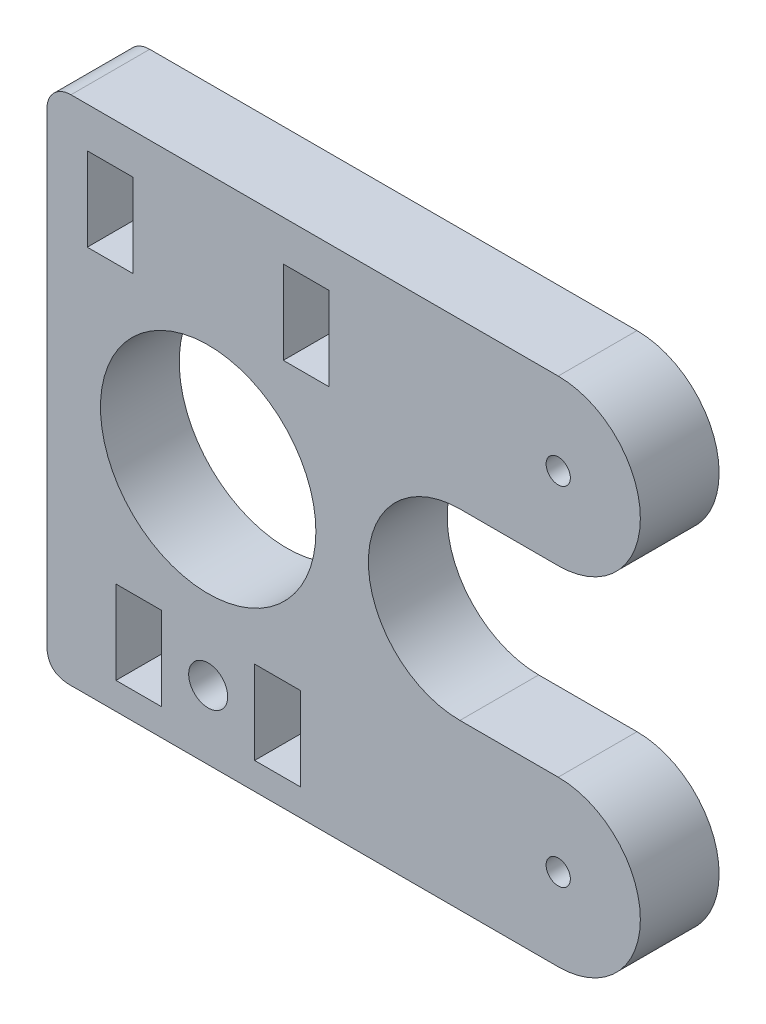
from build123d import *

# Parameters (mm, degrees)
SKETCH1_R           = 0.899918091
SKETCH1_R_2         = 0.899925125
SKETCH1_R_3         = 1.45
SKETCH1_R_4         = 8
SKETCH1_W           = 3.400011
SKETCH1_H           = 6.2
SKETCH1_W_2         = 3.4
BOSS_EXTRUDE2_DEPTH = 5.85


with BuildPart() as part:
    # Sketch1 → Boss-Extrude2 (new body)
    with BuildSketch(Plane.XY):
        with BuildLine():
            Line((669.21684417, 349.76545661), (648.535749201, 349.76545661))
            ThreePointArc((648.535749201, 349.76545661), (647.270566291, 349.24140069), (646.746510371, 347.976217781))
            Line((646.746510371, 347.976217781), (646.746510371, 313.454646051))
            add(Edge.make_bspline(
                [(646.746510371, 313.454646051), (646.746510371, 311.64647079), (648.773268796, 311.76545661)],
                knots=[0, 0, 0, 1, 1, 1], degree=2))
            Line((648.773268796, 311.76545661), (669.21684417, 311.76545661))
            Line((669.21684417, 311.76545661), (684.726521371, 311.76545661))
            ThreePointArc((684.726521371, 311.76545661), (690.826521371, 317.86545661), (684.726521371, 323.96545661))
            Line((684.726521371, 323.96545661), (677.425546339, 323.96545661))
            ThreePointArc((677.425546339, 323.96545661), (670.625546339, 330.76545661), (677.425546339, 337.56545661))
            Line((677.425546339, 337.56545661), (684.726521371, 337.56545661))
            ThreePointArc((684.726521371, 337.56545661), (690.826521371, 343.66545661), (684.726521371, 349.76545661))
            Line((684.726521371, 349.76545661), (669.21684417, 349.76545661))
        make_face()
        with Locations((684.726521371, 343.66545661)):
            Circle(SKETCH1_R, mode=Mode.SUBTRACT)
        with Locations((684.726521371, 317.86545661)):
            Circle(SKETCH1_R_2, mode=Mode.SUBTRACT)
        with Locations((658.726521371, 316.86545661)):
            Circle(SKETCH1_R_3, mode=Mode.SUBTRACT)
        with Locations((658.726521371, 330.76545661)):
            Circle(SKETCH1_R_4, mode=Mode.SUBTRACT)
        with Locations((651.446515871, 343.66545661)):
            Rectangle(SKETCH1_W, SKETCH1_H, mode=Mode.SUBTRACT)
        with Locations((653.576521371, 316.86545661)):
            Rectangle(SKETCH1_W_2, SKETCH1_H, mode=Mode.SUBTRACT)
        with Locations((666.006526871, 343.66545661)):
            Rectangle(SKETCH1_W, SKETCH1_H, mode=Mode.SUBTRACT)
        with Locations((663.876521371, 316.86545661)):
            Rectangle(SKETCH1_W_2, SKETCH1_H, mode=Mode.SUBTRACT)
    extrude(amount=BOSS_EXTRUDE2_DEPTH)


solid = part.part
